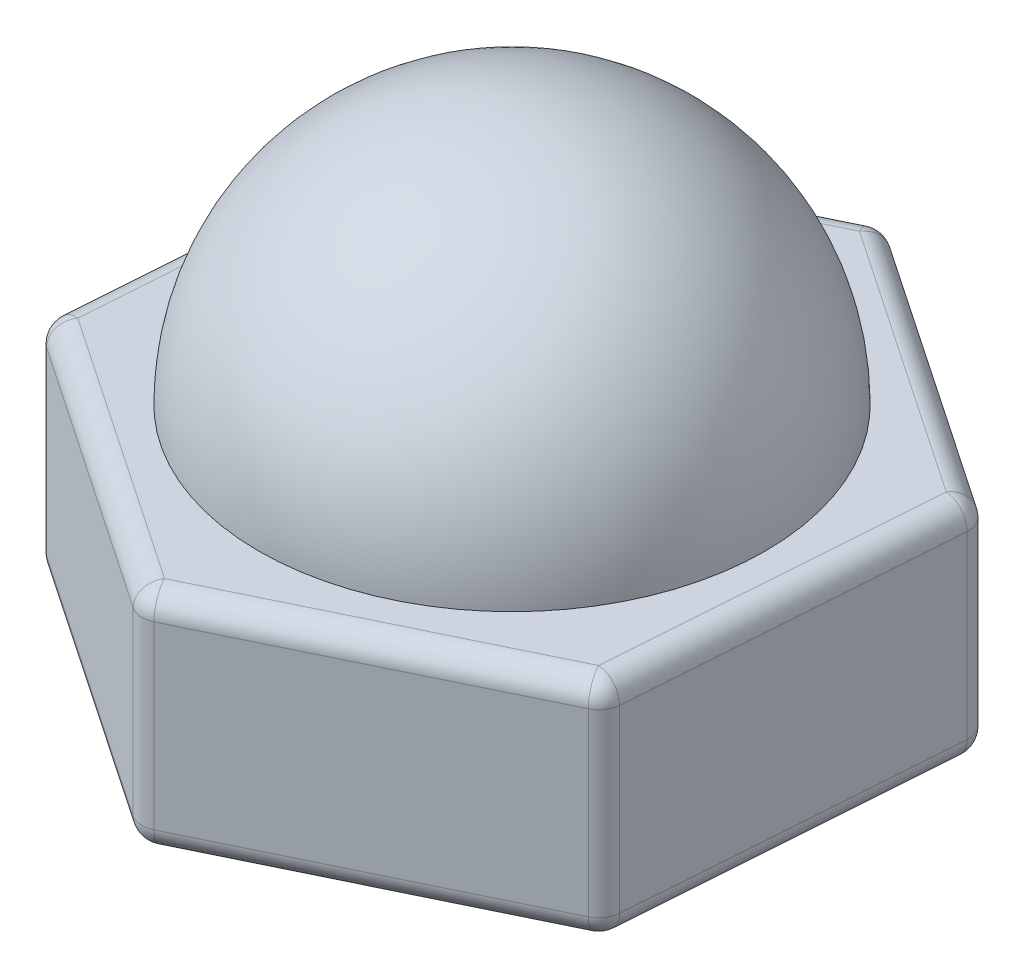
from build123d import *

# Parameters (mm, degrees)
HEXAGONAL_BASE_DEPTH       = 2
BASE_FILLET_R              = 0.2
OUTER_THREAD_CIRCLE_R      = 1.25
OUTER_THREAD_SURFACE_DEPTH = 3.7
THREAD_SWEEP_CUT_PITCH     = 0.48


with BuildPart() as part:
    # Hexagonal Base Sketch → Hexagonal Base (new body)
    with BuildSketch(Plane(origin=(0, 0, 0), x_dir=(1, 0, 0), z_dir=(0, 1, 0))):
        Polygon((-2.580875496, 1.749023063), (-2.805136152, -1.360592212), (-0.224260657, -3.109615275), (2.580875496, -1.749023063), (2.805136152, 1.360592212), (0.224260657, 3.109615275), align=None)
    extrude(amount=HEXAGONAL_BASE_DEPTH)

    # Hemisphere Sketch → Hemisphere (revolve)
    with BuildSketch(Plane.XY):
        with BuildLine():
            Line((0, 2), (0, 4.25))
            ThreePointArc((0, 4.25), (1.590990258, 3.590990258), (2.25, 2))
            Line((2.25, 2), (0, 2))
        make_face()
    revolve(axis=Axis((0, 2, 0), (0, 1, 0)))

    # Base Fillet
    base_fillet_edges = [part.edges().sort_by_distance(p)[0] for p in [
        (0.224260657, 1, -3.109615275),
        (2.805136152, 1, -1.360592212),
        (2.580875496, 1, 1.749023063),
        (-0.224260657, 1, 3.109615275),
        (-2.805136152, 1, 1.360592212),
        (-2.580875496, 1, -1.749023063),
        (-1.514698405, 2, 2.235103743),
        (1.17830742, 2, 2.429319169),
        (2.693005824, 2, 0.194215426),
        (1.514698405, 2, -2.235103743),
        (-1.17830742, 2, -2.429319169),
        (1.514698405, 0, -2.235103743),
        (2.693005824, 0, 0.194215426),
        (1.17830742, 0, 2.429319169),
        (-1.514698405, 0, 2.235103743),
        (-2.693005824, 0, -0.194215426),
        (-1.17830742, 0, -2.429319169),
        (-2.693005824, 2, -0.194215426),
    ]]
    fillet(base_fillet_edges, radius=BASE_FILLET_R)

    # Outer Thread Circle → Outer Thread Surface (cut)
    with BuildSketch(Plane.XZ):
        with Locations(Location((0, 0, 0), (0, 0, 270))):
            Circle(OUTER_THREAD_CIRCLE_R)
    extrude(amount=-OUTER_THREAD_SURFACE_DEPTH, mode=Mode.SUBTRACT)

    # Thread Sweep Cut: the profile of Thread Sweep Cut Profile screwed along a right-hand helix of 9.9375 turns, 6 arcs to a turn; built about Z, then put on its axis
    thread_sweep_cut_z = Axis((0, 0, 0), (0, 0, 1))
    thread_sweep_cut_corners = [(1.219096874, 0, -0.097057529), (1.419096874, 0, -0.033026287), (1.419096874, 0, 0.066973713), (1.219096874, 0, 0.131004956)]
    with BuildLine(mode=Mode.PRIVATE) as thread_sweep_cut_profile:
        Line(thread_sweep_cut_corners[0], thread_sweep_cut_corners[1])
        Line(thread_sweep_cut_corners[1], thread_sweep_cut_corners[2])
        Line(thread_sweep_cut_corners[2], thread_sweep_cut_corners[3])
        Line(thread_sweep_cut_corners[3], thread_sweep_cut_corners[0])
    thread_sweep_cut_cap = Face(thread_sweep_cut_profile.wire())
    thread_sweep_cut_turn_angles = [0, 30, 60, 90, 120, 150, 180, 210, 240, 270, 300, 330, 360]
    thread_sweep_cut_turn_weights = [1, 0.8660254037844387, 1, 0.8660254037844387, 1, 0.8660254037844387, 1, 0.8660254037844387, 1, 0.8660254037844387, 1, 0.8660254037844387, 1]
    thread_sweep_cut_turn_rails = [Edge.make_bspline([Vector(p[0], p[1], 0).rotate(thread_sweep_cut_z, thread_sweep_cut_turn_angles[k]) / thread_sweep_cut_turn_weights[k] + Vector(0, 0, p[2] + THREAD_SWEEP_CUT_PITCH * thread_sweep_cut_turn_angles[k] / 360) for k in range(13)], [0, 0, 0, 1, 1, 2, 2, 3, 3, 4, 4, 5, 5, 6, 6, 6], 2, thread_sweep_cut_turn_weights) for p in thread_sweep_cut_corners]
    thread_sweep_cut_turn_sides = [Face.make_surface_from_curves(thread_sweep_cut_turn_rails[p[0]], thread_sweep_cut_turn_rails[p[1]]) for p in [(0, 1), (1, 2), (2, 3), (3, 0)]]
    thread_sweep_cut_last_angles = [3240, 3270, 3300, 3330, 3360, 3390, 3420, 3450, 3480, 3510, 3540, 3558.75, 3577.5]
    thread_sweep_cut_last_weights = [1, 0.8660254037844387, 1, 0.8660254037844387, 1, 0.8660254037844387, 1, 0.8660254037844387, 1, 0.8660254037844387, 1, 0.946930129495089, 1]
    thread_sweep_cut_last_rails = [Edge.make_bspline([Vector(p[0], p[1], 0).rotate(thread_sweep_cut_z, thread_sweep_cut_last_angles[k]) / thread_sweep_cut_last_weights[k] + Vector(0, 0, p[2] + THREAD_SWEEP_CUT_PITCH * thread_sweep_cut_last_angles[k] / 360) for k in range(13)], [0, 0, 0, 1, 1, 2, 2, 3, 3, 4, 4, 5, 5, 6, 6, 6], 2, thread_sweep_cut_last_weights) for p in thread_sweep_cut_corners]
    thread_sweep_cut_last_sides = [Face.make_surface_from_curves(thread_sweep_cut_last_rails[p[0]], thread_sweep_cut_last_rails[p[1]]) for p in [(0, 1), (1, 2), (2, 3), (3, 0)]]
    thread_sweep_cut = Plane(origin=(0, 3.585, 0), x_dir=(0, 0, 1), z_dir=(0, -1, 0)) * Solid(Shell([*[p.moved(Location((0, 0, THREAD_SWEEP_CUT_PITCH * i))) for i in range(9) for p in thread_sweep_cut_turn_sides], *thread_sweep_cut_last_sides, thread_sweep_cut_cap, thread_sweep_cut_cap.rotate(thread_sweep_cut_z, 3577.5).moved(Location((0, 0, THREAD_SWEEP_CUT_PITCH * 3577.5 / 360)))]))
    add(thread_sweep_cut, mode=Mode.SUBTRACT)


solid = part.part
